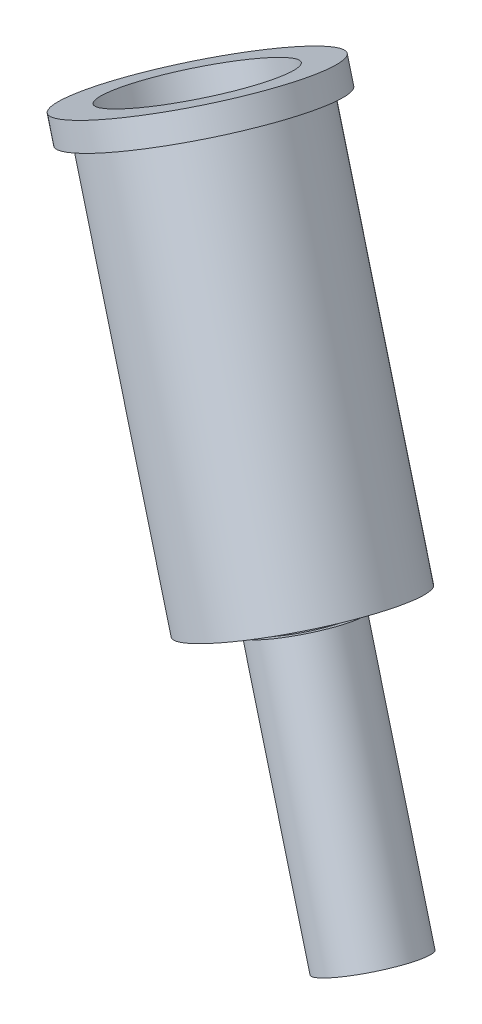
from build123d import *

# Parameters (mm, degrees)
SKETCH1_R           = 11.43
BOSS_EXTRUDE1_DEPTH = 2.54
SKETCH2_R           = 9.9949
BOSS_EXTRUDE2_DEPTH = 38.1
SKETCH3_R           = 3.81
BOSS_EXTRUDE3_DEPTH = 1.016
SKETCH4_R           = 4.7625
BOSS_EXTRUDE4_DEPTH = 26.02818833
SKETCH5_R           = 3.175
CUT_EXTRUDE1_DEPTH  = 91.907301175
SKETCH6_R           = 7.9375
CUT_EXTRUDE2_DEPTH  = 22.86


with BuildPart() as part:
    # Sketch1 → Boss-Extrude1 (new body)
    with BuildSketch(Plane(origin=(-129.203450499, 253.122013832, -50.271342949), x_dir=(0.8839119577418659, 0.40461078724322996, -0.23449895907520743), z_dir=(-0.4476862825736014, 0.8770605813697528, -0.1741887740435096))):
        with Locations((-31.085661697, -28.519102589)):
            Circle(SKETCH1_R)
    extrude(amount=BOSS_EXTRUDE1_DEPTH)

    # Sketch2 → Boss-Extrude2 (add)
    with BuildSketch(Plane(origin=(-129.203450499, 253.122013832, -50.271342949), x_dir=(-0.8839119577418658, -0.4046107872432301, 0.23449895907520704), z_dir=(0.44768628257360144, -0.8770605813697528, 0.17418877404350955))):
        with Locations((31.085661697, -28.519102589)):
            Circle(SKETCH2_R)
    extrude(amount=BOSS_EXTRUDE2_DEPTH)

    # Sketch3 → Boss-Extrude3 (add)
    with BuildSketch(Plane(origin=(-112.146603133, 219.706005682, -43.634750658), x_dir=(-0.8839119577418658, -0.40461078724323, 0.2344989590752073), z_dir=(0.4476862825736014, -0.8770605813697527, 0.17418877404350944))):
        with Locations((31.085661697, -28.519102589)):
            Circle(SKETCH3_R)
    extrude(amount=BOSS_EXTRUDE3_DEPTH)

    # Sketch4 → Boss-Extrude4 (add)
    with BuildSketch(Plane(origin=(-111.69175387, 218.814912131, -43.457774863), x_dir=(-0.8839119577418657, -0.40461078724322985, 0.23449895907520799), z_dir=(0.4476862825736014, -0.8770605813697527, 0.1741887740435095))):
        with Locations((31.085661697, -28.519102589)):
            Circle(SKETCH4_R)
    extrude(amount=BOSS_EXTRUDE4_DEPTH)

    # Sketch5 → Cut-Extrude1 (cut, through all)
    with BuildSketch(Plane(origin=(-130.340573657, 255.349747708, -50.713782435), x_dir=(0.8839119577418658, 0.40461078724323, -0.2344989590752073), z_dir=(-0.4476862825736014, 0.8770605813697528, -0.1741887740435095))):
        with Locations((-31.085661697, -28.519102589)):
            Circle(SKETCH5_R)
    extrude(amount=-CUT_EXTRUDE1_DEPTH, mode=Mode.SUBTRACT)

    # Sketch6 → Cut-Extrude2 (cut)
    with BuildSketch(Plane(origin=(-130.340573657, 255.349747708, -50.713782435), x_dir=(0.8839119577418658, 0.40461078724323, -0.2344989590752073), z_dir=(-0.4476862825736014, 0.8770605813697528, -0.1741887740435095))):
        with Locations((-31.085661697, -28.519102589)):
            Circle(SKETCH6_R)
    extrude(amount=-CUT_EXTRUDE2_DEPTH, mode=Mode.SUBTRACT)


solid = part.part
